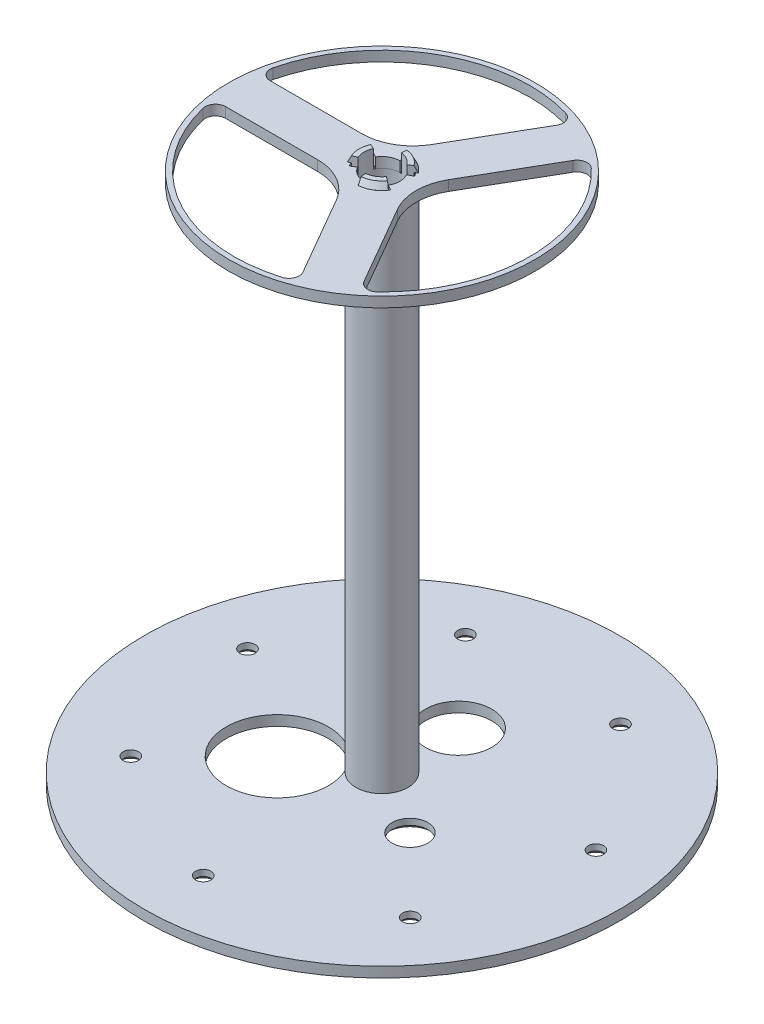
from build123d import *

# Parameters (mm, degrees)
SKETCH1_R           = 46.5
SKETCH1_R_2         = 6.5
SKETCH1_R_3         = 10
SKETCH1_R_4         = 3.5
BOSS_EXTRUDE1_DEPTH = 2
SKETCH3_R           = 5.1
SKETCH3_R_2         = 3.5
BOSS_EXTRUDE2_DEPTH = 100
SKETCH4_R           = 30
SKETCH4_R_2         = 29
BOSS_EXTRUDE5_DEPTH = 2
FILLET1_R           = 10
FILLET2_R           = 2
SKETCH5_R           = 1
SKETCH5_R_2         = 3.5
CUT_EXTRUDE1_DEPTH  = 1
SKETCH6_R           = 1.5
CUT_EXTRUDE2_DEPTH  = 2
CHAMFER2_SIZE       = 0.8
REVOLVE1_ANGLE      = 50
CIRPATTERN1_COUNT   = 3


# Read off the part's stored shape, not the designer's step: Revolve1
with BuildPart() as part:
    # Sketch1 → Boss-Extrude1 (new body)
    with BuildSketch(Plane(origin=(0, 0, 0), x_dir=(1, 0, 0), z_dir=(0, 1, 0))):
        with Locations(Location((0, 0, 0), (0, 0, 270))):
            Circle(SKETCH1_R)
        with Locations(Location((0, 15, 0), (0, 0, 270))):
            Circle(SKETCH1_R_2, mode=Mode.SUBTRACT)
        with Locations(Location((-12.990381057, -7.5, 0), (0, 0, 270))):
            Circle(SKETCH1_R_3, mode=Mode.SUBTRACT)
        with Locations(Location((12.990381057, -7.5, 0), (0, 0, 270))):
            Circle(SKETCH1_R_4, mode=Mode.SUBTRACT)
        with Locations(Location((0, 0, 0), (0, 0, 270))):
            Circle(SKETCH1_R_4, mode=Mode.SUBTRACT)
    extrude(amount=BOSS_EXTRUDE1_DEPTH)

    # Sketch3 → Boss-Extrude2 (add)
    with BuildSketch(Plane(origin=(0, 2, 0), x_dir=(1, 0, 0), z_dir=(0, 1, 0))):
        with Locations(Location((0, 0, 0), (0, 0, 200.748965475))):
            Circle(SKETCH3_R)
        with Locations(Location((0, 0, 0), (0, 0, 270))):
            Circle(SKETCH3_R_2, mode=Mode.SUBTRACT)
    extrude(amount=BOSS_EXTRUDE2_DEPTH)

    # Sketch6 → Cut-Extrude2 (cut)
    with BuildSketch(Plane.XZ):
        with Locations(Location((0, 35, 0), (0, 0, 270))):
            Circle(SKETCH6_R)
        with Locations(Location((27.364101886, 21.822143065, 0), (0, 0, 270))):
            Circle(SKETCH6_R)
        with Locations(Location((34.122476926, -7.788232688, 0), (0, 0, 270))):
            Circle(SKETCH6_R)
        with Locations(Location((15.185930869, -31.533910377, 0), (0, 0, 270))):
            Circle(SKETCH6_R)
        with Locations(Location((-15.185930869, -31.533910377, 0), (0, 0, 270))):
            Circle(SKETCH6_R)
        with Locations(Location((-34.122476926, -7.788232688, 0), (0, 0, 270))):
            Circle(SKETCH6_R)
        with Locations(Location((-27.364101886, 21.822143065, 0), (0, 0, 270))):
            Circle(SKETCH6_R)
    extrude(amount=-CUT_EXTRUDE2_DEPTH, mode=Mode.SUBTRACT)

    # Chamfer2
    chamfer2_edges = [part.edges().sort_by_distance(p)[0] for p in [
        (12.990381057, 0, 4),
        (34.122476926, 0, -6.288232688),
        (27.364101886, 0, 23.322143065),
        (0, 0, 36.5),
        (-27.364101886, 0, 23.322143065),
        (-34.122476926, 0, -6.288232688),
        (-15.185930869, 0, -30.033910377),
        (15.185930869, 0, -30.033910377),
    ]]
    chamfer(chamfer2_edges, length=CHAMFER2_SIZE)


with BuildPart() as body_2:
    # Sketch4 → Boss-Extrude5 (new body)
    # profile 1 of 13: a face of its own
    with BuildSketch(Plane(origin=(0, 102, 0), x_dir=(1, 0, 0), z_dir=(0, 1, 0))):
        with Locations(Location((0, 0, 0), (0, 0, 270))):
            Circle(SKETCH4_R)
        Circle(SKETCH4_R_2, mode=Mode.SUBTRACT)
    # profile 2 of 13: a face of its own
    with BuildSketch(Plane(origin=(0, 102, 0), x_dir=(1, 0, 0), z_dir=(0, 1, 0))):
        with BuildLine():
            Line((10.555107028, 27.010918452), (-2.460515776, 4.467198464))
            ThreePointArc((-2.460515776, 4.467198464), (-1.265958194, 4.940379525), (0.008950407, 5.099992146))
            ThreePointArc((0.008950407, 5.099992146), (2.557747353, 4.412247554), (4.421197961, 2.542244793))
            ThreePointArc((4.421197961, 2.542244793), (4.918455601, 1.348626894), (5.099542425, 0.068315834))
            Line((5.099542425, 0.068315834), (18.128572143, 22.635257278))
            ThreePointArc((18.128572143, 22.635257278), (14.507755353, 25.110257558), (10.555107028, 27.010918452))
        make_face()
    # profile 3 of 13: a face of its own
    with BuildSketch(Plane(origin=(0, 102, 0), x_dir=(1, 0, 0), z_dir=(0, 1, 0))):
        with BuildLine():
            ThreePointArc((-4.412247554, 2.557747353), (-3.633233752, 3.5790519), (-2.623748403, 4.373321886))
            Line((-2.623748403, 4.373321886), (-28.668345883, 4.373321886))
            ThreePointArc((-28.668345883, 4.373321886), (-29, 0), (-28.668345883, -4.373321886))
            Line((-28.668345883, -4.373321886), (-2.623748403, -4.373321886))
            ThreePointArc((-2.623748403, -4.373321886), (-3.639509328, -3.572670129), (-4.421197961, -2.542244793))
            ThreePointArc((-4.421197961, -2.542244793), (-5.099992146, 0.008950407), (-4.412247554, 2.557747353))
        make_face()
    # profile 4 of 13: a face of its own
    with BuildSketch(Plane(origin=(0, 102, 0), x_dir=(1, 0, 0), z_dir=(0, 1, 0))):
        with BuildLine():
            Line((-2.346434517, -4.528161333), (10.619428606, -26.985695027))
            ThreePointArc((10.619428606, -26.985695027), (14.567551204, -25.075614687), (18.182472179, -22.591983212))
            Line((18.182472179, -22.591983212), (5.099542425, 0.068315834))
            ThreePointArc((5.099542425, 0.068315834), (5.099885605, 0.034158683), (5.1, 0))
            ThreePointArc((5.1, 0), (4.925061549, -1.324299338), (4.412247554, -2.557747353))
            ThreePointArc((4.412247554, -2.557747353), (2.542244793, -4.421197961), (-0.008950407, -5.099992146))
            ThreePointArc((-0.008950407, -5.099992146), (-1.211902288, -4.953916919), (-2.346434517, -4.528161333))
        make_face()
    # profile 5 of 13: a face of its own
    with BuildSketch(Plane(origin=(0, 102, 0), x_dir=(1, 0, 0), z_dir=(0, 1, 0))):
        with BuildLine():
            Line((-2.460515776, 4.467198464), (-2.514715444, 4.373321886))
            Line((-2.514715444, 4.373321886), (-2.623748403, 4.373321886))
            ThreePointArc((-2.623748403, 4.373321886), (-3.633233752, 3.5790519), (-4.412247554, 2.557747353))
            Line((-4.412247554, 2.557747353), (-4.066188922, 2.357139718))
            ThreePointArc((-4.066188922, 2.357139718), (-2.342853045, 4.074437337), (0.008248414, 4.699992762))
            Line((0.008248414, 4.699992762), (0.008950407, 5.099992146))
            ThreePointArc((0.008950407, 5.099992146), (-1.265958194, 4.940379525), (-2.460515776, 4.467198464))
        make_face()
    # profile 6 of 13: a face of its own
    with BuildSketch(Plane(origin=(0, 102, 0), x_dir=(1, 0, 0), z_dir=(0, 1, 0))):
        with BuildLine():
            ThreePointArc((0.008248414, 4.699992762), (-2.342853045, 4.074437337), (-4.066188922, 2.357139718))
            Line((-4.066188922, 2.357139718), (-3.028013027, 1.755316811))
            ThreePointArc((-3.028013027, 1.755316811), (-1.744677799, 3.034155464), (0.006142436, 3.49999461))
            Line((0.006142436, 3.49999461), (0.008248414, 4.699992762))
        make_face()
    # profile 7 of 13: a face of its own
    with BuildSketch(Plane(origin=(0, 102, 0), x_dir=(1, 0, 0), z_dir=(0, 1, 0))):
        with BuildLine():
            ThreePointArc((4.7, 0), (4.54091706, 1.212465364), (4.074437337, 2.342853045))
            Line((4.074437337, 2.342853045), (3.034155464, 1.744677799))
            ThreePointArc((3.034155464, 1.744677799), (3.38153398, 0.902899739), (3.5, 0))
            ThreePointArc((3.5, 0), (3.3799442, -0.908832879), (3.028013027, -1.755316811))
            Line((3.028013027, -1.755316811), (4.066188922, -2.357139718))
            ThreePointArc((4.066188922, -2.357139718), (4.538782212, -1.220432723), (4.7, 0))
        make_face()
    # profile 8 of 13: a face of its own
    with BuildSketch(Plane(origin=(0, 102, 0), x_dir=(1, 0, 0), z_dir=(0, 1, 0))):
        with BuildLine():
            ThreePointArc((5.099542425, 0.068315834), (4.918455601, 1.348626894), (4.421197961, 2.542244793))
            Line((4.421197961, 2.542244793), (4.074437337, 2.342853045))
            ThreePointArc((4.074437337, 2.342853045), (4.54091706, 1.212465364), (4.7, 0))
            ThreePointArc((4.7, 0), (4.538782212, -1.220432723), (4.066188922, -2.357139718))
            Line((4.066188922, -2.357139718), (4.412247554, -2.557747353))
            ThreePointArc((4.412247554, -2.557747353), (4.925061549, -1.324299338), (5.1, 0))
            ThreePointArc((5.1, 0), (5.099885605, 0.034158683), (5.099542425, 0.068315834))
        make_face()
    # profile 9 of 13: a face of its own
    with BuildSketch(Plane(origin=(0, 102, 0), x_dir=(1, 0, 0), z_dir=(0, 1, 0))):
        with BuildLine():
            ThreePointArc((4.421197961, 2.542244793), (2.557747353, 4.412247554), (0.008950407, 5.099992146))
            Line((0.008950407, 5.099992146), (0.008248414, 4.699992762))
            ThreePointArc((0.008248414, 4.699992762), (2.357139718, 4.066188922), (4.074437337, 2.342853045))
            Line((4.074437337, 2.342853045), (4.421197961, 2.542244793))
        make_face()
    # profile 10 of 13: a face of its own
    with BuildSketch(Plane(origin=(0, 102, 0), x_dir=(1, 0, 0), z_dir=(0, 1, 0))):
        with BuildLine():
            ThreePointArc((4.066188922, -2.357139718), (2.342853045, -4.074437337), (-0.008248414, -4.699992762))
            Line((-0.008248414, -4.699992762), (-0.008950407, -5.099992146))
            ThreePointArc((-0.008950407, -5.099992146), (2.542244793, -4.421197961), (4.412247554, -2.557747353))
            Line((4.412247554, -2.557747353), (4.066188922, -2.357139718))
        make_face()
    # profile 11 of 13: a face of its own
    with BuildSketch(Plane(origin=(0, 102, 0), x_dir=(1, 0, 0), z_dir=(0, 1, 0))):
        with BuildLine():
            Line((-4.074437337, -2.342853045), (-4.421197961, -2.542244793))
            ThreePointArc((-4.421197961, -2.542244793), (-3.639509328, -3.572670129), (-2.623748403, -4.373321886))
            Line((-2.623748403, -4.373321886), (-2.435831114, -4.373321886))
            Line((-2.435831114, -4.373321886), (-2.346434517, -4.528161333))
            ThreePointArc((-2.346434517, -4.528161333), (-1.211902288, -4.953916919), (-0.008950407, -5.099992146))
            Line((-0.008950407, -5.099992146), (-0.008248414, -4.699992762))
            ThreePointArc((-0.008248414, -4.699992762), (-2.357139718, -4.066188922), (-4.074437337, -2.342853045))
        make_face()
    # profile 12 of 13: a face of its own
    with BuildSketch(Plane(origin=(0, 102, 0), x_dir=(1, 0, 0), z_dir=(0, 1, 0))):
        with BuildLine():
            Line((-3.034155464, -1.744677799), (-4.074437337, -2.342853045))
            ThreePointArc((-4.074437337, -2.342853045), (-2.357139718, -4.066188922), (-0.008248414, -4.699992762))
            Line((-0.008248414, -4.699992762), (-0.006142436, -3.49999461))
            ThreePointArc((-0.006142436, -3.49999461), (-1.755316811, -3.028013027), (-3.034155464, -1.744677799))
        make_face()
    # profile 13 of 13: a face of its own
    with BuildSketch(Plane(origin=(0, 102, 0), x_dir=(1, 0, 0), z_dir=(0, 1, 0))):
        with BuildLine():
            Line((-4.066188922, 2.357139718), (-4.412247554, 2.557747353))
            ThreePointArc((-4.412247554, 2.557747353), (-5.099992146, 0.008950407), (-4.421197961, -2.542244793))
            Line((-4.421197961, -2.542244793), (-4.074437337, -2.342853045))
            ThreePointArc((-4.074437337, -2.342853045), (-4.699992762, 0.008248414), (-4.066188922, 2.357139718))
        make_face()
    extrude(amount=BOSS_EXTRUDE5_DEPTH)

    # Fillet1
    fillet1_edges = [body_2.edges().sort_by_distance(p)[0] for p in [
        (5.099542425, 103, -0.068315834),
        (-2.435831114, 103, 4.373321886),
        (-2.514715444, 103, -4.373321886),
    ]]
    fillet(fillet1_edges, radius=FILLET1_R)

    # Fillet2
    fillet2_edges = [body_2.edges().sort_by_distance(p)[0] for p in [
        (18.182472179, 103, 22.591983212),
        (18.128572143, 103, -22.635257278),
        (10.619428606, 103, 26.985695027),
        (-28.668345883, 103, 4.373321886),
        (10.555107028, 103, -27.010918452),
        (-28.668345883, 103, -4.373321886),
    ]]
    fillet(fillet2_edges, radius=FILLET2_R)

    # Sketch5 → Cut-Extrude1 (cut)
    with BuildSketch(Plane.XZ.offset(-102)):
        with Locations(Location((-15, 0, 0), (0, 0, 270))):
            Circle(SKETCH5_R)
        with Locations(Location((7.5, 12.990381057, 0), (0, 0, 270))):
            Circle(SKETCH5_R_2)
        Polygon((8.383974596, -16.52146997), (4.883974596, -10.459292144), (6.616025404, -9.459292144), (10.116025404, -15.52146997), align=None)
    extrude(amount=-CUT_EXTRUDE1_DEPTH, mode=Mode.SUBTRACT)


with BuildPart() as body_3:
    # Revolve1 outline → Revolve1 (revolve)
    with BuildSketch(Plane(origin=(0, 0, 0), x_dir=(-0.9063077870366494, 0, -0.4226182617407007), z_dir=(0.4226182617407007, 0, -0.9063077870366494))):
        Polygon((3.5, 105.5), (3.5, 102), (4.5, 102), (4.5, 104.3), (5.1, 104.3), (4.5, 105.5), align=None)
    revolve1 = revolve(axis=Axis((0, 0, 0), (0, 1, 0)), revolution_arc=REVOLVE1_ANGLE)


with BuildPart() as part_1:
    add(part.part)

    # CirPattern1: Revolve1 ×3 about axis
    cirpattern1_axis = Axis((0, 102, 0), (0, -1, 0))
    for i in range(1, CIRPATTERN1_COUNT):
        add(revolve1.rotate(cirpattern1_axis, i * 360 / CIRPATTERN1_COUNT))


with BuildPart() as body_3_1:
    add(body_3.part)

    # Combine2: union part
    add(part_1.part)


solid = Compound([body_2.part, body_3_1.part])
